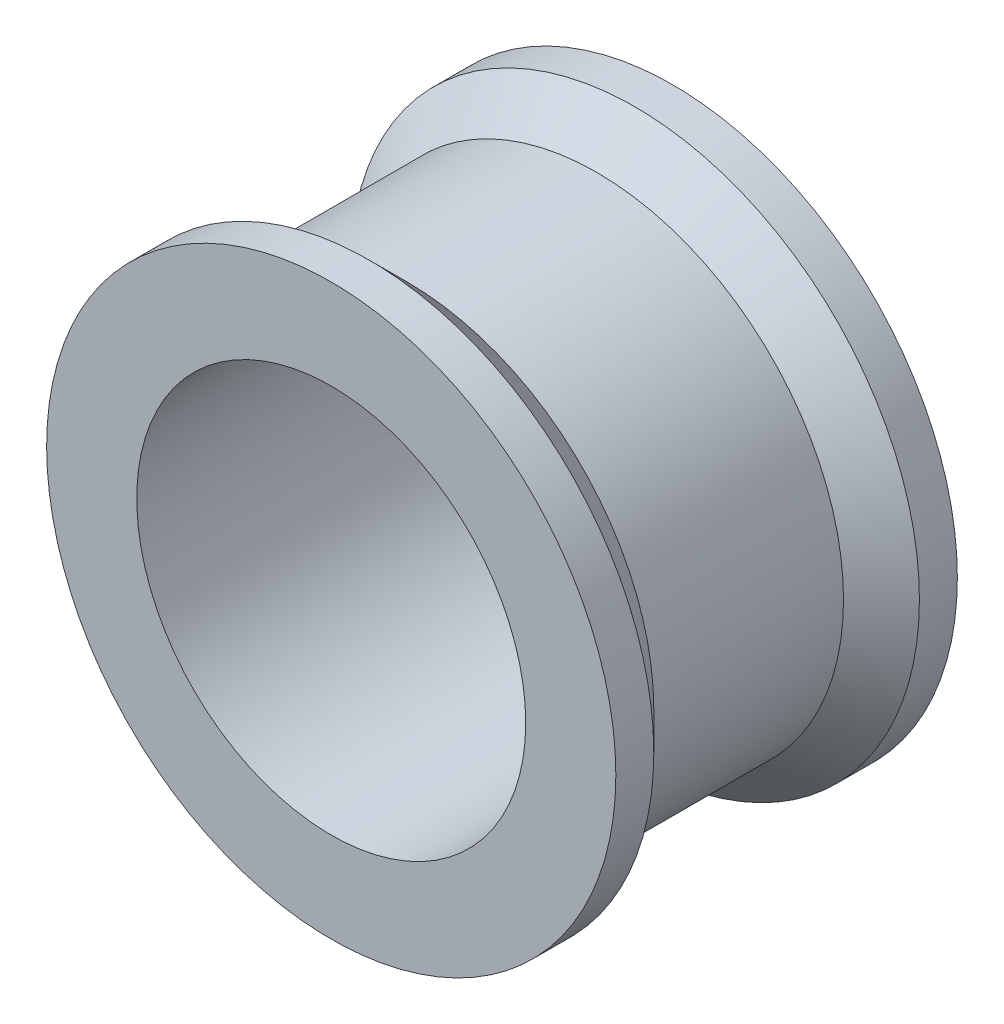
from build123d import *

# Parameters (mm, degrees)
SKETCH1_R           = 7.5
SKETCH1_R_2         = 5.125
BOSS_EXTRUDE1_DEPTH = 1
SKETCH2_R           = 6.5
SKETCH2_R_2         = 5.125
BOSS_EXTRUDE2_DEPTH = 3.5
CHAMFER1_SIZE       = 1


with BuildPart() as part:
    # Sketch1 → Boss-Extrude1 (new body)
    with BuildSketch(Plane.XY):
        Circle(SKETCH1_R)
        Circle(SKETCH1_R_2, mode=Mode.SUBTRACT)
    extrude(amount=BOSS_EXTRUDE1_DEPTH)

    # Sketch2 → Boss-Extrude2 (add)
    with BuildSketch(Plane.XY.offset(1)):
        Circle(SKETCH2_R)
        Circle(SKETCH2_R_2, mode=Mode.SUBTRACT)
    extrude(amount=BOSS_EXTRUDE2_DEPTH)

    # Chamfer1
    chamfer1_edges = [part.edges().sort_by_distance(p)[0] for p in [
        (-6.5, 0, 1),
    ]]
    chamfer(chamfer1_edges, length=CHAMFER1_SIZE - 0.0001)  # a hair under: the kernel refuses the full size

    # Mirror5: part across plane


with BuildPart() as part_1:
    add(part.part)
    add(part.part.mirror(Plane.XY.offset(4.5)))


solid = part_1.part
